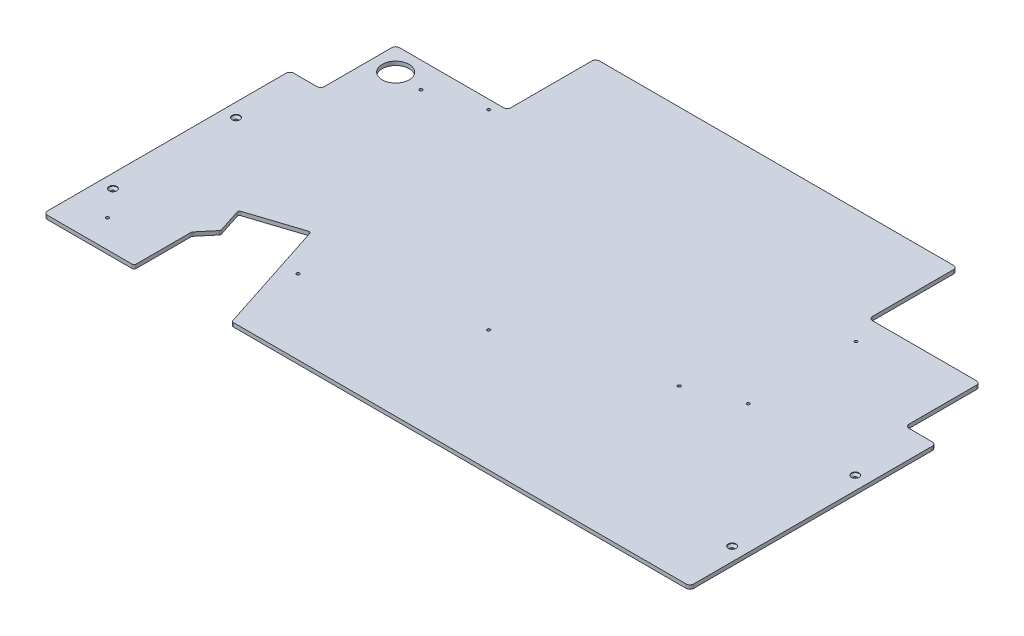
from build123d import *

# Parameters (mm, degrees)
SKETCH1_R                                     = 3.3734375
BOSS_EXTRUDE1_DEPTH                           = 6.35
SKETCH3_R                                     = 2.45745
SKETCH3_R_2                                   = 22.225
CUT_EXTRUDE2_DEPTH                            = 1264.111411604
CUT_EXTRUDE1_DEPTH                            = 1264.111411604
CSK_FOR_1_4_FLAT_HEAD_MACHINE_SCREW1_AT_COUNT = 2
CSK_FOR_1_4_FLAT_HEAD_MACHINE_SCREW1_AT_PITCH = 1022.35
CSK_FOR_1_4_FLAT_HEAD_MACHINE_SCREW1_2_COUNT  = 2
CSK_FOR_1_4_FLAT_HEAD_MACHINE_SCREW1_2_PITCH  = 203.2
CSK_FOR_1_4_FLAT_HEAD_MACHINE_SCREW1_3_COUNT  = 2
CSK_FOR_1_4_FLAT_HEAD_MACHINE_SCREW1_3_PITCH  = 1042.348196382
FILLET1_R                                     = 6.35
FILLET3_R                                     = 3.175


with BuildPart() as part:
    # Sketch1 → Boss-Extrude1 (new body)
    with BuildSketch(Plane(origin=(0, 0, 0), x_dir=(1, 0, 0), z_dir=(0, 1, 0))):
        Polygon((1016, 406.4), (1066.8, 406.4), (1066.8, 0), (0, 0), (0, 406.4), (50.8, 406.4), (50.8, 530.225), (234.95, 530.225), (234.95, 676.275), (831.85, 676.275), (831.85, 530.225), (1016, 530.225), align=None)
        with Locations((22.225, 92.075)):
            Circle(SKETCH1_R, mode=Mode.SUBTRACT)
        with Locations((1044.575, 92.075)):
            Circle(SKETCH1_R, mode=Mode.SUBTRACT)
        with Locations((22.225, 295.275)):
            Circle(SKETCH1_R, mode=Mode.SUBTRACT)
        with Locations((1044.575, 295.275)):
            Circle(SKETCH1_R, mode=Mode.SUBTRACT)
    extrude(amount=BOSS_EXTRUDE1_DEPTH)

    # Sketch3 → Cut-Extrude2 (cut, through all)
    with BuildSketch(Plane(origin=(0, 6.35, 0), x_dir=(1, 0, 0), z_dir=(0, 1, 0))):
        with Locations((134.9375, 487.748914195)):
            Circle(SKETCH3_R)
        with Locations((219.486424299, 515.220524995)):
            Circle(SKETCH3_R)
        with Locations((59.31154, 45.87748)):
            Circle(SKETCH3_R)
        with Locations((296.845703608, 123.057008284)):
            Circle(SKETCH3_R)
        with Locations((534.379867216, 200.236536569)):
            Circle(SKETCH3_R)
        with Locations((771.914030824, 277.416064853)):
            Circle(SKETCH3_R)
        with Locations((854.075, 309.0545)):
            Circle(SKETCH3_R)
        with Locations((854.075, 486.8545)):
            Circle(SKETCH3_R)
        with Locations((88.9, 492.125)):
            Circle(SKETCH3_R_2)
    extrude(amount=-CUT_EXTRUDE2_DEPTH, mode=Mode.SUBTRACT)

    # Sketch2 → Cut-Extrude1 (cut, through all)
    with BuildSketch(Plane(origin=(0, 6.35, 0), x_dir=(1, 0, 0), z_dir=(0, 1, 0))):
        Polygon((310.578822168, 0), (149.225, 0), (149.225, 95.25), (171.033618902, 121.240499926), (157.061866823, 164.241131286), (247.65, 193.675), align=None)
    extrude(amount=-CUT_EXTRUDE1_DEPTH, mode=Mode.SUBTRACT)

    # Sketch5 → CSK for 1/4 Flat Head Machine Screw1 (revolve, cut)
    with BuildSketch(Plane(origin=(22.225, 6.35, -92.075), x_dir=(0, 0, 1), z_dir=(1, 0, 0))):
        Polygon((0, 0), (0, 6.35), (3.3782, 6.35), (3.3782, 4.536932584), (6.4389, 1.016), (6.4389, 0), align=None)
    csk_for_1_4_flat_head_machine_screw1 = revolve(axis=Axis((22.225, 12.7, -92.075), (0, -1, 0)), mode=Mode.SUBTRACT)

    # CSK for 1/4 Flat Head Machine Screw1 at: CSK for 1/4 Flat Head Machine Screw1 ×2
    with Locations(*[(i * CSK_FOR_1_4_FLAT_HEAD_MACHINE_SCREW1_AT_PITCH, 0, 0) for i in range(1, CSK_FOR_1_4_FLAT_HEAD_MACHINE_SCREW1_AT_COUNT)]):
        add(csk_for_1_4_flat_head_machine_screw1, mode=Mode.SUBTRACT)

    # CSK for 1_4 Flat Head Machine Screw1 2: CSK for 1/4 Flat Head Machine Screw1 ×2
    with Locations(*[(0, 0, -i * CSK_FOR_1_4_FLAT_HEAD_MACHINE_SCREW1_2_PITCH) for i in range(1, CSK_FOR_1_4_FLAT_HEAD_MACHINE_SCREW1_2_COUNT)]):
        add(csk_for_1_4_flat_head_machine_screw1, mode=Mode.SUBTRACT)

    # CSK for 1_4 Flat Head Machine Screw1 3: CSK for 1/4 Flat Head Machine Screw1 ×2
    with Locations(*[Vector(0.9808142840837317, 0, -0.19494445397937524) * (i * CSK_FOR_1_4_FLAT_HEAD_MACHINE_SCREW1_3_PITCH) for i in range(1, CSK_FOR_1_4_FLAT_HEAD_MACHINE_SCREW1_3_COUNT)]):
        add(csk_for_1_4_flat_head_machine_screw1, mode=Mode.SUBTRACT)

    # Fillet1
    fillet1_edges = [part.edges().sort_by_distance(p)[0] for p in [
        (50.8, 3.175, -406.4),
        (0, 3.175, -406.4),
        (50.8, 3.175, -530.225),
        (234.95, 3.175, -530.225),
        (234.95, 3.175, -676.275),
        (0, 3.175, 0),
        (1066.8, 3.175, 0),
        (1066.8, 3.175, -406.4),
        (1016, 3.175, -406.4),
        (1016, 3.175, -530.225),
        (831.85, 3.175, -530.225),
        (831.85, 3.175, -676.275),
    ]]
    fillet(fillet1_edges, radius=FILLET1_R)

    # Fillet3
    fillet3_edges = [part.edges().sort_by_distance(p)[0] for p in [
        (310.578822168, 3.175, 0),
        (247.65, 3.175, -193.675),
        (157.061866823, 3.175, -164.241131286),
        (171.033618902, 3.175, -121.240499926),
        (149.225, 3.175, -95.25),
        (149.225, 3.175, 0),
    ]]
    fillet(fillet3_edges, radius=FILLET3_R)


solid = part.part
